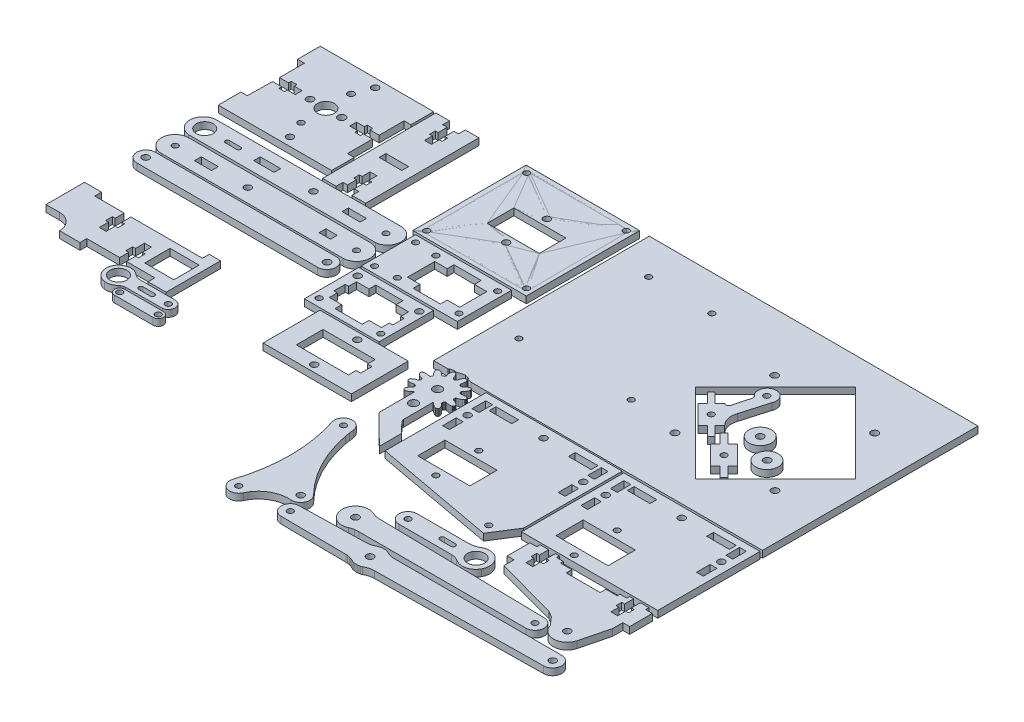
from build123d import *

# Parameters (mm, degrees)
SKETCH3_R              = 3.75
SKETCH3_R_2            = 1.53326
SKETCH3_R_3            = 1.42391285
SKETCH3_R_4            = 1.648176726
SKETCH3_R_5            = 1.5
SKETCH3_R_6            = 1.352434515
SKETCH3_R_7            = 1.489057141
BOSS_EXTRUDE1_DEPTH    = 3
SKETCH5_W              = 10
SKETCH5_H              = 3
BOSS_EXTRUDE2_DEPTH    = 3
SKETCH8_R              = 1.5
SKETCH8_R_2            = 1.500007616
SKETCH8_R_3            = 1.299978659
SKETCH8_R_4            = 1.299998754
SKETCH8_R_5            = 1.294984531
SKETCH8_R_6            = 1.2999789
SKETCH8_W              = 23
SKETCH8_H              = 11.8
BOSS_EXTRUDE3_DEPTH    = 3
SKETCH14_R             = 5.00001662
SKETCH14_R_2           = 1.550029918
BOSS_EXTRUDE5_DEPTH    = 3
SKETCH14_R_3           = 5.003976988
SKETCH14_R_4           = 1.550023427
BOSS_EXTRUDE5_2_DEPTH  = 3
SKETCH14_R_5           = 1.299993938
SKETCH14_R_6           = 1.300026864
BOSS_EXTRUDE5_3_DEPTH  = 3
SKETCH14_R_7           = 1.299969961
BOSS_EXTRUDE5_4_DEPTH  = 3
SKETCH10_W             = 145.044336183
SKETCH10_H             = 95.097461227
SKETCH10_R             = 1.550506139
SKETCH10_R_2           = 1.300168844
SKETCH10_R_3           = 1.2905
SKETCH10_R_4           = 1.55
SKETCH10_R_5           = 1.564093454
SKETCH10_R_6           = 1.556446812
BOSS_EXTRUDE4_DEPTH    = 3
SKETCH16_W             = 60.073762511
SKETCH16_H             = 45.112571339
SKETCH16_R             = 1.5
SKETCH16_R_2           = 1.2999789
SKETCH16_R_3           = 1.296234989
SKETCH16_R_4           = 1.500012067
SKETCH16_W_2           = 10
SKETCH16_H_2           = 3
SKETCH16_W_3           = 3
SKETCH16_H_3           = 6
SKETCH16_W_4           = 23
SKETCH16_H_4           = 12
BOSS_EXTRUDE6_DEPTH    = 3
SKETCH18_R             = 1.3
SKETCH18_R_2           = 3.75
BOSS_EXTRUDE7_DEPTH    = 3
SKETCH18_R_3           = 1.300013016
SKETCH18_R_4           = 1.549974532
BOSS_EXTRUDE7_2_DEPTH  = 3
SKETCH18_R_5           = 1.300006116
SKETCH18_R_6           = 1.54998491
SKETCH18_R_7           = 1.499986033
BOSS_EXTRUDE7_3_DEPTH  = 3
SKETCH18_R_8           = 1.500000462
SKETCH18_R_9           = 1.300040399
SKETCH18_R_10          = 1.299952653
BOSS_EXTRUDE7_4_DEPTH  = 3
SKETCH18_W             = 12.829032701
SKETCH18_H             = 11.189767412
BOSS_EXTRUDE7_5_DEPTH  = 3
SKETCH18_R_11          = 3.750002352
BOSS_EXTRUDE7_6_DEPTH  = 3
SKETCH18_R_12          = 1.300003796
SKETCH18_R_13          = 1.299998754
BOSS_EXTRUDE7_7_DEPTH  = 3
SKETCH18_W_2           = 42.429633814
SKETCH18_H_2           = 23.954946388
SKETCH18_R_14          = 1.298883823
SKETCH18_R_15          = 1.299997434
SKETCH18_R_16          = 1.298943094
SKETCH18_R_17          = 1.299995677
SKETCH18_R_18          = 1.2989
SKETCH18_R_19          = 1.30391221
BOSS_EXTRUDE7_8_DEPTH  = 3
SKETCH18_W_3           = 32.923456075
SKETCH18_H_3           = 23.983775616
SKETCH18_R_20          = 1.501568812
SKETCH18_R_21          = 1.29891
SKETCH18_R_22          = 1.30127611
SKETCH18_R_23          = 1.500007616
BOSS_EXTRUDE7_9_DEPTH  = 3
SKETCH18_R_24          = 3.750099942
SKETCH18_R_25          = 1.5
SKETCH18_W_4           = 8
SKETCH18_H_4           = 2.8
SKETCH18_W_5           = 9
SKETCH18_H_5           = 2.9
BOSS_EXTRUDE7_10_DEPTH = 3
SKETCH18_R_26          = 1.299997387
SKETCH18_W_6           = 7.5
SKETCH18_H_6           = 3
SKETCH18_W_7           = 5
BOSS_EXTRUDE7_11_DEPTH = 3
SKETCH18_R_27          = 1.550000311
SKETCH18_R_28          = 1.550002261
BOSS_EXTRUDE7_12_DEPTH = 3
SKETCH18_W_8           = 38.915686477
SKETCH18_H_7           = 25.075379571
BOSS_EXTRUDE7_13_DEPTH = 3
SKETCH17_R             = 1.5
BOSS_EXTRUDE8_DEPTH    = 3
SKETCH23_R             = 1.502981158
SKETCH23_R_2           = 1.299837753
SKETCH23_R_3           = 1.299813959
SKETCH23_R_4           = 1.311183002
SKETCH23_R_5           = 1.5
SKETCH23_W             = 10
SKETCH23_H             = 3
SKETCH23_W_2           = 3
SKETCH23_H_2           = 6
SKETCH23_W_3           = 23
SKETCH23_H_3           = 12
BOSS_EXTRUDE9_DEPTH    = 3
SKETCH27_R             = 10.542052595
BOSS_EXTRUDE13_DEPTH   = 3
CUT_EXTRUDE5_START     = -1
CUT_EXTRUDE5_DEPTH     = 348.879953887
CIRPATTERN1_COUNT      = 12
SKETCH28_R             = 1.9
BOSS_EXTRUDE14_DEPTH   = 3
SKETCH29_R             = 1.9
CUT_EXTRUDE6_DEPTH     = 3
SKETCH30_W             = 50.052698669
SKETCH30_H             = 49.917064019
SKETCH30_R             = 1.295977319
SKETCH30_R_2           = 1.498315826
SKETCH30_R_3           = 1.299978659
SKETCH30_R_4           = 1.493585645
SKETCH30_R_5           = 1.298054303
SKETCH30_R_6           = 1.295949613
SKETCH30_W_2           = 23.14749428
SKETCH30_H_2           = 11.799314187
BOSS_EXTRUDE15_DEPTH   = 3


with BuildPart() as part:
    # Sketch3 → Boss-Extrude1 (new body)
    with BuildSketch(Plane(origin=(0, 0, 0), x_dir=(1, 0, 0), z_dir=(0, 1, 0))):
        Polygon((0, 0), (50, 0), (50, -10), (47, -10), (47, -21), (43, -21), (43, -19.82589), (40.5, -19.75), (40.5, -21), (37, -21), (37, -24), (40.5, -24), (40.5, -25.274955495), (43, -25.25), (43, -24), (47, -24), (47, -35), (50, -35), (50, -45), (0, -45), (0, -35), (2.827127063, -35), (3, -24), (7, -24), (7, -25.274955495), (9.5, -25.17411), (9.5, -24), (13, -24), (13, -21), (9.5, -21), (9.5, -19.82589), (7, -19.82589), (7, -21), (3, -21), (3, -10), (0, -10), align=None)
        with Locations((25, -22.499992494)):
            Circle(SKETCH3_R, mode=Mode.SUBTRACT)
        with Locations((18, -22.5)):
            Circle(SKETCH3_R_2, mode=Mode.SUBTRACT)
        with Locations((24.990375, -11.417625)):
            Circle(SKETCH3_R_3, mode=Mode.SUBTRACT)
        with Locations((31.950646971, -22.511932172)):
            Circle(SKETCH3_R_4, mode=Mode.SUBTRACT)
        with Locations((28, -3.75)):
            Circle(SKETCH3_R_5, mode=Mode.SUBTRACT)
        with Locations((25, -33.494077682)):
            Circle(SKETCH3_R_6, mode=Mode.SUBTRACT)
        with Locations((27.986369291, -41.339428739)):
            Circle(SKETCH3_R_7, mode=Mode.SUBTRACT)
    extrude(amount=BOSS_EXTRUDE1_DEPTH)


with BuildPart() as body_2:
    # Sketch5 → Boss-Extrude2 (new body)
    with BuildSketch(Plane(origin=(0, 0, 0), x_dir=(1, 0, 0), z_dir=(0, 1, 0))):
        Polygon((57, 0), (57, -3), (59, -3), (59, -7), (57.75, -7), (57.75, -9.5), (59, -9.5), (59, -13), (62, -13), (62, -9.5), (63.25, -9.5), (63.25, -7), (62, -7), (62, -3), (64, -3), (64, 0), (70, 0), (70, -50), (64, -50), (64, -47), (62, -47), (62, -43), (63.25, -43), (63.25, -40.5), (62, -40.5), (62, -37), (59, -37), (59, -40.5), (57.75, -40.5), (57.75, -43), (59, -43), (59, -47), (57, -47), (57, -50), (51, -50), (51, 0), align=None)
        with Locations((60.5, -28)):
            Rectangle(SKETCH5_W, SKETCH5_H, mode=Mode.SUBTRACT)
    extrude(amount=BOSS_EXTRUDE2_DEPTH)


with BuildPart() as body_3:
    # Sketch8 → Boss-Extrude3 (new body)
    with BuildSketch(Plane(origin=(0, 0, 0), x_dir=(1, 0, 0), z_dir=(0, 1, 0))):
        Polygon((90.835790983, -0.1468305), (90.835790983, -49.979936215), (140.829753359, -49.979936215), (140.829753359, 0), align=None)
        with Locations((116, -16.000034227)):
            Circle(SKETCH8_R, mode=Mode.SUBTRACT)
        with Locations((116, -34)):
            Circle(SKETCH8_R_2, mode=Mode.SUBTRACT)
        with Locations((138, -3)):
            Circle(SKETCH8_R_3, mode=Mode.SUBTRACT)
        with Locations((94, -47)):
            Circle(SKETCH8_R_4, mode=Mode.SUBTRACT)
        with Locations((93.972384297, -2.870240899)):
            Circle(SKETCH8_R_5, mode=Mode.SUBTRACT)
        with Locations((138, -47)):
            Circle(SKETCH8_R_6, mode=Mode.SUBTRACT)
        with Locations((116, -25)):
            Rectangle(SKETCH8_W, SKETCH8_H, mode=Mode.SUBTRACT)
    extrude(amount=BOSS_EXTRUDE3_DEPTH)


with BuildPart() as body_4:
    # Sketch14 → Boss-Extrude5 (new body)
    with BuildSketch(Plane(origin=(0, 0, 0), x_dir=(1, 0, 0), z_dir=(0, 1, 0))):
        with Locations((246.15535, -52.035605)):
            Circle(SKETCH14_R)
        with Locations((246.15535, -52.035605)):
            Circle(SKETCH14_R_2, mode=Mode.SUBTRACT)
    extrude(amount=BOSS_EXTRUDE5_DEPTH)


with BuildPart() as body_5:
    # Sketch14 → Boss-Extrude5 2 (new body)
    with BuildSketch(Plane(origin=(0, 0, 0), x_dir=(1, 0, 0), z_dir=(0, 1, 0))):
        with Locations((256.781771683, -59.687732945)):
            Circle(SKETCH14_R_3)
        with Locations((256.82285, -59.64665)):
            Circle(SKETCH14_R_4, mode=Mode.SUBTRACT)
    extrude(amount=BOSS_EXTRUDE5_2_DEPTH)


with BuildPart() as body_6:
    # Sketch14 → Boss-Extrude5 3 (new body)
    with BuildSketch(Plane(origin=(0, 0, 0), x_dir=(1, 0, 0), z_dir=(0, 1, 0))):
        with BuildLine():
            Line((234.1407, -55.70278), (232.0194, -57.8241))
            Line((232.0194, -57.8241), (236.262, -62.06674))
            Line((236.262, -62.06674), (234.565, -63.7638))
            Line((234.565, -63.7638), (230.3223, -59.52115))
            Line((230.3223, -59.52115), (228.201, -61.64247))
            Line((228.201, -61.64247), (219.7157, -53.15719))
            Line((219.7157, -53.15719), (221.837, -51.03587))
            Line((221.837, -51.03587), (217.5944, -46.79323))
            Line((217.5944, -46.79323), (219.2915, -45.09618))
            Line((219.2915, -45.09618), (223.5341, -49.33882))
            Line((223.5341, -49.33882), (225.6554, -47.2175))
            ThreePointArc((225.6554, -47.2175), (227.096966061, -47.504240019), (227.913545624, -46.282139221))
            Line((227.913545624, -46.282139221), (229.7551, -39.43538))
            Line((229.7551, -39.43538), (229.7551, -38.198592891))
            ThreePointArc((229.7551, -38.198592891), (231.075391639, -31.018520336), (235.828906167, -36.559342615))
            Line((235.828906167, -36.559342615), (232.44365, -48.27816))
            ThreePointArc((232.44365, -48.27816), (232.223292436, -52.234785151), (234.1407, -55.70278))
        make_face()
        with Locations((232.1046, -35.11147)):
            Circle(SKETCH14_R_5, mode=Mode.SUBTRACT)
        with Locations((226.9282, -54.429985)):
            Circle(SKETCH14_R_6, mode=Mode.SUBTRACT)
    extrude(amount=BOSS_EXTRUDE5_3_DEPTH)


with BuildPart() as body_7:
    # Sketch14 → Boss-Extrude5 4 (new body)
    with BuildSketch(Plane(origin=(0, 0, 0), x_dir=(1, 0, 0), z_dir=(0, 1, 0))):
        Polygon((244.0402, -59.94542), (252.5255, -68.4307), (250.4042, -70.55202), (254.6468, -74.79466), (252.9497, -76.49172), (248.7071, -72.24908), (246.5858, -74.3704), (238.1005, -65.88512), (240.2218, -63.7638), (235.9792, -59.52115), (237.6762, -57.8241), (241.9189, -62.06674), align=None)
        with Locations((245.313, -67.157905)):
            Circle(SKETCH14_R_7, mode=Mode.SUBTRACT)
    extrude(amount=BOSS_EXTRUDE5_4_DEPTH)


with BuildPart() as body_8:
    # Sketch10 → Boss-Extrude4 (new body)
    with BuildSketch(Plane(origin=(0, 0, 0), x_dir=(1, 0, 0), z_dir=(0, 1, 0))):
        with Locations((217.677521451, -47.548730614)):
            Rectangle(SKETCH10_W, SKETCH10_H)
        with Locations((226.009129523, -25.539997746)):
            Circle(SKETCH10_R, mode=Mode.SUBTRACT)
        with Locations((188.502678827, -15.722061434)):
            Circle(SKETCH10_R_2, mode=Mode.SUBTRACT)
        with Locations((160.602678827, -15.722061434)):
            Circle(SKETCH10_R_2, mode=Mode.SUBTRACT)
        with Locations((155.5, -67.875)):
            Circle(SKETCH10_R_3, mode=Mode.SUBTRACT)
        with Locations((203.702678827, -66.522061434)):
            Circle(SKETCH10_R_2, mode=Mode.SUBTRACT)
        with Locations((226, -69.5)):
            Circle(SKETCH10_R_4, mode=Mode.SUBTRACT)
        with Locations((270.124359095, -25.491820621)):
            Circle(SKETCH10_R_5, mode=Mode.SUBTRACT)
        with Locations((270.107264834, -69.483321735)):
            Circle(SKETCH10_R_6, mode=Mode.SUBTRACT)
        Polygon((248.173093133, -12.095839846), (283.382605742, -47.305352454), (248.173093133, -82.514865063), (212.963580525, -47.305352454), align=None, mode=Mode.SUBTRACT)
    extrude(amount=BOSS_EXTRUDE4_DEPTH)

    # Sketch27 → Boss-Extrude13 (add)
    with BuildSketch(Plane(origin=(0, 0, 0), x_dir=(1, 0, 0), z_dir=(0, 1, 0))):
        with Locations((156.933289023, -105.157126991)):
            Circle(SKETCH27_R)
    extrude(amount=BOSS_EXTRUDE13_DEPTH)

    # Sketch24 → Cut-Extrude5 (cut)
    with BuildSketch(Plane(origin=(0, 0, 0), x_dir=(1, 0, 0), z_dir=(0, 1, 0)).offset(CUT_EXTRUDE5_START)):
        Polygon((146.295463365, -102.258026196), (146.734120528, -102.514029645), (146.734120528, -102.846697253), (146.8825, -103.1532), (147.0178, -103.3192), (147.4553, -103.675), (147.9381, -103.9665), (148.4567, -104.1881), (149.001, -104.3353), (149.2258, -104.4129), (149.421, -104.5485), (149.572, -104.7322), (149.6674, -104.9499), (149.6674, -105.086518838), (149.6674, -105.35931762), (149.6674, -105.57468508), (149.421, -105.8223), (149.1134, -105.957095774), (148.843969569, -106.075164966), (148.4567, -106.1828), (147.9381, -106.4044), (147.4553, -106.723311534), (147.0178, -107.0517), (146.8825, -107.2176), (146.7646, -107.6252), (146.7905, -107.8378), (146.387479964, -107.886897925), (145.400373324, -104.3353), (145.873599656, -102.6992775), align=None)
    cut_extrude5 = extrude(amount=CUT_EXTRUDE5_DEPTH, mode=Mode.SUBTRACT)

    # CirPattern1: Cut-Extrude5 ×12 about axis
    cirpattern1_axis = Axis((156.933289023, 3, 105.157126991), (0, -1, 0))
    for i in range(1, CIRPATTERN1_COUNT):
        add(cut_extrude5.rotate(cirpattern1_axis, i * 360 / CIRPATTERN1_COUNT), mode=Mode.SUBTRACT)

    # Sketch28 → Boss-Extrude14 (add)
    with BuildSketch(Plane(origin=(0, 0, 0), x_dir=(1, 0, 0), z_dir=(0, 1, 0))):
        Polygon((165.897383159, -139.82250261), (165.897383159, -130.125905708), (161.277, -125.2548), (160.9869, -124.3621), (160.927849447, -111.240792422), (152.884646942, -111.319726794), (152.884646942, -126.99508265), align=None)
        with Locations((156.95902597, -115.808287016)):
            Circle(SKETCH28_R, mode=Mode.SUBTRACT)
    extrude(amount=BOSS_EXTRUDE14_DEPTH)

    # Sketch29 → Cut-Extrude6 (cut)
    with BuildSketch(Plane(origin=(0, 0, 0), x_dir=(1, 0, 0), z_dir=(0, 1, 0))):
        with Locations((156.916793387, -105.137173192)):
            Circle(SKETCH29_R)
    extrude(amount=CUT_EXTRUDE6_DEPTH, mode=Mode.SUBTRACT)


with BuildPart() as body_9:
    # Sketch16 → Boss-Extrude6 (new body)
    with BuildSketch(Plane(origin=(0, 0, 0), x_dir=(1, 0, 0), z_dir=(0, 1, 0))):
        with Locations((260.007317348, -118.580980031)):
            Rectangle(SKETCH16_W, SKETCH16_H)
        with Locations((260, -100.5)):
            Circle(SKETCH16_R, mode=Mode.SUBTRACT)
        with Locations((250.5, -119.5)):
            Circle(SKETCH16_R_2, mode=Mode.SUBTRACT)
        with Locations((250.5, -138.465098587)):
            Circle(SKETCH16_R_3, mode=Mode.SUBTRACT)
        with Locations((285.5, -108.5)):
            Circle(SKETCH16_R, mode=Mode.SUBTRACT)
        with Locations((234.5, -108.5)):
            Circle(SKETCH16_R_4, mode=Mode.SUBTRACT)
        with Locations((242.5, -100.5)):
            Rectangle(SKETCH16_W_2, SKETCH16_H_2, mode=Mode.SUBTRACT)
        with Locations((277.5, -100.5)):
            Rectangle(SKETCH16_W_2, SKETCH16_H_2, mode=Mode.SUBTRACT)
        with Locations((285.5, -102)):
            Rectangle(SKETCH16_W_3, SKETCH16_H_3, mode=Mode.SUBTRACT)
        with Locations((285.5, -115)):
            Rectangle(SKETCH16_W_3, SKETCH16_H_3, mode=Mode.SUBTRACT)
        with Locations((250.5, -129)):
            Rectangle(SKETCH16_W_4, SKETCH16_H_4, mode=Mode.SUBTRACT)
        with Locations((234.5, -115)):
            Rectangle(SKETCH16_W_3, SKETCH16_H_3, mode=Mode.SUBTRACT)
        with Locations((234.5, -102)):
            Rectangle(SKETCH16_W_3, SKETCH16_H_3, mode=Mode.SUBTRACT)
    extrude(amount=BOSS_EXTRUDE6_DEPTH)


with BuildPart() as body_10:
    # Sketch18 → Boss-Extrude7 (new body)
    with BuildSketch(Plane(origin=(0, 0, 0), x_dir=(1, 0, 0), z_dir=(0, 1, 0))):
        with BuildLine():
            Line((200, -157.2561), (222.460912978, -157.2561))
            ThreePointArc((222.460912978, -157.2561), (225.201625308, -156.860687351), (227.7188, -155.7067))
            ThreePointArc((227.7188, -155.7067), (234.425465186, -157.247273828), (235.304856395, -164.072183846))
            ThreePointArc((235.304856395, -164.072183846), (231.298299739, -167.169454238), (226.342, -166.1299))
            ThreePointArc((226.342, -166.1299), (224.771562074, -165.505823803), (223.0953, -165.2916))
            Line((223.0953, -165.2916), (200, -165.2561))
            ThreePointArc((200, -165.2561), (196, -161.2561), (200, -157.2561))
        make_face()
        with Locations((200, -161.2561)):
            Circle(SKETCH18_R, mode=Mode.SUBTRACT)
        with Locations((230, -161.2561)):
            Circle(SKETCH18_R_2, mode=Mode.SUBTRACT)
        with BuildLine():
            Line((215.010554012, -160.267363361), (219.919025801, -160.267363361))
            ThreePointArc((219.919025801, -160.267363361), (220.932172771, -161.280510331), (219.919025801, -162.293657301))
            Line((219.919025801, -162.293657301), (215.010554012, -162.293657301))
            ThreePointArc((215.010554012, -162.293657301), (213.997407042, -161.280510331), (215.010554012, -160.267363361))
        make_face(mode=Mode.SUBTRACT)
    extrude(amount=BOSS_EXTRUDE7_DEPTH)


with BuildPart() as body_11:
    # Sketch18 → Boss-Extrude7 2 (new body)
    with BuildSketch(Plane(origin=(0, 0, 0), x_dir=(1, 0, 0), z_dir=(0, 1, 0))):
        with BuildLine():
            Line((267.8316, -169.0008), (193.5528, -167.5414))
            ThreePointArc((193.5528, -167.5414), (192.887635317, -167.455400386), (192.219, -167.4028))
            ThreePointArc((192.219, -167.4028), (191.55333704, -167.293716328), (190.927, -167.0433))
            ThreePointArc((190.927, -167.0433), (189.004137555, -166.359961344), (186.9656, -166.2666))
            ThreePointArc((186.9656, -166.2666), (183.057707097, -168.375067718), (181.785321347, -172.629277111))
            ThreePointArc((181.785321347, -172.629277111), (182.766023818, -175.434472878), (184.9077, -177.4946))
            ThreePointArc((184.9077, -177.4946), (187.529228779, -178.261740952), (190.201, -177.6938))
            ThreePointArc((190.201, -177.6938), (191.138575639, -177.324647201), (192.1236, -177.1124))
            ThreePointArc((192.1236, -177.1124), (193.072931136, -177.018971757), (194.026338605, -176.987784562))
            Line((194.026338605, -176.987784562), (267.753, -177))
            ThreePointArc((267.753, -177), (271.752817879, -173.03931598), (267.8316, -169.0008))
        make_face()
        with Locations((267.75305, -173)):
            Circle(SKETCH18_R_3, mode=Mode.SUBTRACT)
        with Locations((187.7569, -172.2142)):
            Circle(SKETCH18_R_4, mode=Mode.SUBTRACT)
    extrude(amount=BOSS_EXTRUDE7_2_DEPTH)


with BuildPart() as body_12:
    # Sketch18 → Boss-Extrude7 3 (new body)
    with BuildSketch(Plane(origin=(0, 0, 0), x_dir=(1, 0, 0), z_dir=(0, 1, 0))):
        with BuildLine():
            Line((170.9118, -180.2312), (199.7222, -179.5779))
            ThreePointArc((199.7222, -179.5779), (201.8376067, -179.258428395), (203.8045, -178.4168))
            ThreePointArc((203.8045, -178.4168), (204.091909858, -178.286013473), (204.4002, -178.2177))
            ThreePointArc((204.4002, -178.2177), (204.710444247, -178.165809141), (205.0136, -178.0819))
            ThreePointArc((205.0136, -178.0819), (205.321933314, -178.013737517), (205.6377, -178.0111))
            ThreePointArc((205.6377, -178.0111), (205.951938844, -178.024906904), (206.2659, -178.0058))
            ThreePointArc((206.2659, -178.0058), (206.581681815, -178.003169495), (206.8911, -178.0663))
            ThreePointArc((206.8911, -178.0663), (207.195554991, -178.145209985), (207.5066, -178.1918))
            ThreePointArc((207.5066, -178.1918), (207.816056495, -178.254878116), (208.1056, -178.381))
            ThreePointArc((208.1056, -178.381), (208.387003464, -178.521505982), (208.6816, -178.6317))
            ThreePointArc((208.6816, -178.6317), (209.028512895, -178.762712354), (209.3587, -178.9315))
            ThreePointArc((209.3587, -178.9315), (209.697618418, -179.085368069), (210.0607, -179.1673))
            ThreePointArc((210.0607, -179.1673), (210.425847774, -179.23210759), (210.7815, -179.3372))
            ThreePointArc((210.7815, -179.3372), (211.142946952, -179.426036198), (211.5149, -179.4397))
            ThreePointArc((211.5149, -179.4397), (211.885759287, -179.436159612), (212.2547, -179.474))
            Line((212.2547, -179.474), (286, -179.474))
            ThreePointArc((286, -179.474), (289.999936464, -183.44772236), (286.0526, -187.4737))
            Line((286.0526, -187.4737), (212.3137, -188.4434))
            ThreePointArc((212.3137, -188.4434), (210.172193977, -188.749428152), (208.1793, -189.5909))
            ThreePointArc((208.1793, -189.5909), (207.891445225, -189.720719249), (207.5829, -189.7879))
            ThreePointArc((207.5829, -189.7879), (207.272504044, -189.838638491), (206.9691, -189.9215))
            ThreePointArc((206.9691, -189.9215), (206.660508026, -189.988642594), (206.3447, -189.9902))
            ThreePointArc((206.3447, -189.9902), (206.030521556, -189.975273726), (205.7165, -189.9932))
            ThreePointArc((205.7165, -189.9932), (205.400707852, -189.994666467), (205.0915, -189.9305))
            ThreePointArc((205.0915, -189.9305), (204.787292957, -189.850585166), (204.4764, -189.8029))
            ThreePointArc((204.4764, -189.8029), (204.167188014, -189.738719346), (203.8781, -189.6116))
            ThreePointArc((203.8781, -189.6116), (203.597188037, -189.470098991), (203.303, -189.3588))
            ThreePointArc((203.303, -189.3588), (202.961060971, -189.228132955), (202.6358, -189.0602))
            ThreePointArc((202.6358, -189.0602), (202.302040587, -188.90677466), (201.9442, -188.8238))
            ThreePointArc((201.9442, -188.8238), (201.584178805, -188.757466456), (201.2338, -188.6514))
            ThreePointArc((201.2338, -188.6514), (200.877693771, -188.56114241), (200.5107, -188.5446))
            ThreePointArc((200.5107, -188.5446), (200.14467333, -188.544853065), (199.7809, -188.5043))
            Line((199.7809, -188.5043), (170.9644, -188.2299))
            ThreePointArc((170.9644, -188.2299), (167.002618868, -184.256429994), (170.9118, -180.2312))
        make_face()
        with Locations((171.00245, -184.2301)):
            Circle(SKETCH18_R_5, mode=Mode.SUBTRACT)
        with Locations((206.00175, -184)):
            Circle(SKETCH18_R_6, mode=Mode.SUBTRACT)
        with Locations((286, -183.474)):
            Circle(SKETCH18_R_7, mode=Mode.SUBTRACT)
    extrude(amount=BOSS_EXTRUDE7_3_DEPTH)


with BuildPart() as body_13:
    # Sketch18 → Boss-Extrude7 4 (new body)
    with BuildSketch(Plane(origin=(0, 0, 0), x_dir=(1, 0, 0), z_dir=(0, 1, 0))):
        with BuildLine():
            Line((154.2411, -141.4201), (154.5835, -143.5068))
            ThreePointArc((154.5835, -143.5068), (160.144624366, -159.404783515), (170.0608, -173.0188))
            ThreePointArc((170.0608, -173.0188), (170.830688309, -177.531456134), (166.8709, -179.8286))
            ThreePointArc((166.8709, -179.8286), (159.030856109, -181.627977059), (153.6593, -187.6155))
            ThreePointArc((153.6593, -187.6155), (148.567775867, -189.700195924), (146.2067, -184.7308))
            ThreePointArc((146.2067, -184.7308), (149.661659143, -162.874197015), (146.170332469, -141.023373809))
            ThreePointArc((146.170332469, -141.023373809), (149.132248913, -135.851413376), (153.9775, -139.3221))
            Line((153.9775, -139.3221), (154.2411, -141.4201))
        make_face()
        with Locations((167.22995, -175.84475)):
            Circle(SKETCH18_R_8, mode=Mode.SUBTRACT)
        with Locations((150, -186)):
            Circle(SKETCH18_R_9, mode=Mode.SUBTRACT)
        with Locations((150, -139.7458)):
            Circle(SKETCH18_R_10, mode=Mode.SUBTRACT)
    extrude(amount=BOSS_EXTRUDE7_4_DEPTH)


with BuildPart() as body_14:
    # Sketch18 → Boss-Extrude7 5 (new body)
    with BuildSketch(Plane(origin=(0, 0, 0), x_dir=(1, 0, 0), z_dir=(0, 1, 0))):
        with BuildLine():
            Line((20.5, -107), (7.5, -107))
            Line((7.5, -107), (7.5, -104))
            Line((7.5, -104), (0, -104))
            Line((0, -104), (0, -121))
            Line((0, -121), (6, -121))
            ThreePointArc((6, -121), (10.949747468, -123.050252532), (13, -128))
            Line((13, -128), (22, -128))
            Line((22, -128), (22, -125))
            Line((22, -125), (36.5, -125))
            Line((36.5, -125), (36.5, -121))
            Line((36.5, -121), (35.25, -121))
            Line((35.25, -121), (35.25, -118))
            Line((35.25, -118), (36.5, -118))
            Line((36.5, -118), (36.5, -114))
            Line((36.5, -114), (39.5, -114))
            Line((39.5, -114), (39.5, -118))
            Line((39.5, -118), (40.75, -118))
            Line((40.75, -118), (40.75, -121))
            Line((40.75, -121), (39.5, -121))
            Line((39.5, -121), (39.5, -125))
            Line((39.5, -125), (52, -125))
            Line((52, -125), (52, -128))
            Line((52, -128), (60, -128))
            Line((60, -128), (60, -104))
            Line((60, -104), (55, -104))
            Line((55, -104), (55, -107))
            Line((55, -107), (23.5, -107))
            Line((23.5, -107), (23.5, -111))
            Line((23.5, -111), (24.75, -111))
            Line((24.75, -111), (24.75, -114))
            Line((24.75, -114), (23.5, -114))
            Line((23.5, -114), (23.5, -118))
            Line((23.5, -118), (20.5, -118))
            Line((20.5, -118), (20.5, -114))
            Line((20.5, -114), (19.25, -114))
            Line((19.25, -114), (19.25, -111))
            Line((19.25, -111), (20.5, -111))
            Line((20.5, -111), (20.5, -107))
        make_face()
        with Locations((50.526628558, -115.951763078)):
            Rectangle(SKETCH18_W, SKETCH18_H, mode=Mode.SUBTRACT)
    extrude(amount=BOSS_EXTRUDE7_5_DEPTH)


with BuildPart() as body_15:
    # Sketch18 → Boss-Extrude7 6 (new body)
    with BuildSketch(Plane(origin=(0, 0, 0), x_dir=(1, 0, 0), z_dir=(0, 1, 0))):
        with BuildLine():
            Line((64.95448, -129), (49.75522, -129))
            ThreePointArc((49.75522, -129), (47.712701098, -128.587313557), (45.99063, -127.414))
            ThreePointArc((45.99063, -127.414), (37.87780457, -130.093403704), (42.22112, -137.4509))
            ThreePointArc((42.22112, -137.4509), (44.797074902, -137.216380757), (46.98538, -135.8373))
            ThreePointArc((46.98538, -135.8373), (47.218685761, -135.655018367), (47.49213, -135.5415))
            ThreePointArc((47.49213, -135.5415), (48.051403531, -135.365158762), (48.59174, -135.1373))
            Line((48.59174, -135.1373), (49.16944, -135.0344))
            Line((49.16944, -135.0344), (65.42379, -134.9631))
            ThreePointArc((65.42379, -134.9631), (67.945249696, -131.764637289), (64.95448, -129))
        make_face()
        with Locations((42.95448, -132)):
            Circle(SKETCH18_R_11, mode=Mode.SUBTRACT)
        with Locations((64.95448, -132)):
            Circle(SKETCH18_R, mode=Mode.SUBTRACT)
        with BuildLine():
            Line((52.879559015, -131.026796451), (57.938701055, -131.026796451))
            ThreePointArc((57.938701055, -131.026796451), (58.911922505, -132.000017901), (57.938701055, -132.97323935))
            Line((57.938701055, -132.97323935), (52.879559015, -132.97323935))
            ThreePointArc((52.879559015, -132.97323935), (51.906337565, -132.000017901), (52.879559015, -131.026796451))
        make_face(mode=Mode.SUBTRACT)
    extrude(amount=BOSS_EXTRUDE7_6_DEPTH)


with BuildPart() as body_16:
    # Sketch18 → Boss-Extrude7 7 (new body)
    with BuildSketch(Plane(origin=(0, 0, 0), x_dir=(1, 0, 0), z_dir=(0, 1, 0))):
        with BuildLine():
            Line((49.75522, -136), (66.75522, -136))
            ThreePointArc((66.75522, -136), (69.00522, -138.25), (66.75522, -140.5))
            Line((66.75522, -140.5), (49.75522, -140.5))
            ThreePointArc((49.75522, -140.5), (47.50522, -138.25), (49.75522, -136))
        make_face()
        with Locations((49.75522, -138.25)):
            Circle(SKETCH18_R_12, mode=Mode.SUBTRACT)
        with Locations((66.75522, -138.25)):
            Circle(SKETCH18_R_13, mode=Mode.SUBTRACT)
    extrude(amount=BOSS_EXTRUDE7_7_DEPTH)


with BuildPart() as body_17:
    # Sketch18 → Boss-Extrude7 8 (new body)
    with BuildSketch(Plane(origin=(0, 0, 0), x_dir=(1, 0, 0), z_dir=(0, 1, 0))):
        with Locations((114.225592474, -62.995130295)):
            Rectangle(SKETCH18_W_2, SKETCH18_H_2)
        with Locations((105.5, -71.5)):
            Circle(SKETCH18_R_14, mode=Mode.SUBTRACT)
        with Locations((96, -72.05)):
            Circle(SKETCH18_R_15, mode=Mode.SUBTRACT)
        with Locations((105.5, -54.5)):
            Circle(SKETCH18_R_16, mode=Mode.SUBTRACT)
        with Locations((96, -53.95)):
            Circle(SKETCH18_R_17, mode=Mode.SUBTRACT)
        with Locations((132.7, -71.5)):
            Circle(SKETCH18_R_18, mode=Mode.SUBTRACT)
        with Locations((132.704492308, -54.463182304)):
            Circle(SKETCH18_R_19, mode=Mode.SUBTRACT)
        Polygon((113, -54), (125, -54), (125, -57), (130.5, -57), (130.5, -69), (125, -69), (125, -72), (113, -72), (113, -69), (107.5, -69), (107.5, -57), (113, -57), align=None, mode=Mode.SUBTRACT)
    extrude(amount=BOSS_EXTRUDE7_8_DEPTH)


with BuildPart() as body_18:
    # Sketch18 → Boss-Extrude7 9 (new body)
    with BuildSketch(Plane(origin=(0, 0, 0), x_dir=(1, 0, 0), z_dir=(0, 1, 0))):
        with Locations((109.472503605, -88.008698539)):
            Rectangle(SKETCH18_W_3, SKETCH18_H_3)
        with Locations((95.995543612, -79.512733943)):
            Circle(SKETCH18_R_20, mode=Mode.SUBTRACT)
        with Locations((96, -96.5)):
            Circle(SKETCH18_R_21, mode=Mode.SUBTRACT)
        with Locations((123.206540144, -96.482670767)):
            Circle(SKETCH18_R_22, mode=Mode.SUBTRACT)
        with Locations((123.2, -79.5)):
            Circle(SKETCH18_R_23, mode=Mode.SUBTRACT)
        Polygon((103.5, -79), (115.5, -79), (115.5, -82), (121, -82), (121, -85.5), (122.5, -85.5), (122.5, -90.5), (121, -90.5), (121, -94), (115.5, -94), (115.5, -97), (103.5, -97), (103.5, -94), (98, -94), (98, -90.5), (96.5, -90.5), (96.5, -85.5), (98, -85.5), (98, -82), (103.5, -82), align=None, mode=Mode.SUBTRACT)
    extrude(amount=BOSS_EXTRUDE7_9_DEPTH)


with BuildPart() as body_19:
    # Sketch18 → Boss-Extrude7 10 (new body)
    with BuildSketch(Plane(origin=(0, 0, 0), x_dir=(1, 0, 0), z_dir=(0, 1, 0))):
        with BuildLine():
            Line((5.328213, -51.03773), (86.67179, -51.03773))
            ThreePointArc((86.67179, -51.03773), (92.587015781, -56.630083622), (87.33513, -62.84957))
            Line((87.33513, -62.84957), (4.664874, -62.84957))
            ThreePointArc((4.664874, -62.84957), (-0.587012753, -56.630084068), (5.328213, -51.03773))
        make_face()
        with Locations((6.007668696, -56.973882888)):
            Circle(SKETCH18_R_24, mode=Mode.SUBTRACT)
        with Locations((86, -57)):
            Circle(SKETCH18_R, mode=Mode.SUBTRACT)
        with Locations((54, -57)):
            Circle(SKETCH18_R_25, mode=Mode.SUBTRACT)
        with Locations((72, -57)):
            Rectangle(SKETCH18_W_4, SKETCH18_H_4, mode=Mode.SUBTRACT)
        with Locations((33.5, -56.95)):
            Rectangle(SKETCH18_W_5, SKETCH18_H_5, mode=Mode.SUBTRACT)
        with BuildLine():
            Line((16, -56.088578854), (20.972747325, -56.088578854))
            ThreePointArc((20.972747325, -56.088578854), (21.858051359, -56.973882888), (20.972747325, -57.859186922))
            Line((20.972747325, -57.859186922), (16, -57.859186922))
            ThreePointArc((16, -57.859186922), (15.114695966, -56.973882888), (16, -56.088578854))
        make_face(mode=Mode.SUBTRACT)
    extrude(amount=BOSS_EXTRUDE7_10_DEPTH)


with BuildPart() as body_20:
    # Sketch18 → Boss-Extrude7 11 (new body)
    with BuildSketch(Plane(origin=(0, 0, 0), x_dir=(1, 0, 0), z_dir=(0, 1, 0))):
        with BuildLine():
            Line((86, -64), (6, -64))
            ThreePointArc((6, -64), (-0.053754882, -69.963055849), (5.909300967, -76.016810731))
            Line((5.909300967, -76.016810731), (86, -76))
            Line((86, -76), (86, -76.016810731))
            ThreePointArc((86, -76.016810731), (92.008405366, -70.008405366), (86, -64))
        make_face()
        with Locations((86, -70)):
            Circle(SKETCH18_R_26, mode=Mode.SUBTRACT)
        with Locations((38, -70)):
            Circle(SKETCH18_R_25, mode=Mode.SUBTRACT)
        with Locations((6, -70)):
            Circle(SKETCH18_R, mode=Mode.SUBTRACT)
        with Locations((19.75, -70)):
            Rectangle(SKETCH18_W_6, SKETCH18_H_6, mode=Mode.SUBTRACT)
        with Locations((73.5, -70)):
            Rectangle(SKETCH18_W_7, SKETCH18_H_6, mode=Mode.SUBTRACT)
    extrude(amount=BOSS_EXTRUDE7_11_DEPTH)


with BuildPart() as body_21:
    # Sketch18 → Boss-Extrude7 12 (new body)
    with BuildSketch(Plane(origin=(0, 0, 0), x_dir=(1, 0, 0), z_dir=(0, 1, 0))):
        with BuildLine():
            Line((4.1132945, -76.880456687), (83.901791656, -76.880456687))
            ThreePointArc((83.901791656, -76.880456687), (87.987884236, -80.966549267), (83.901791656, -85.052641847))
            Line((83.901791656, -85.052641847), (4.1132945, -85.052641847))
            ThreePointArc((4.1132945, -85.052641847), (0.02720192, -80.966549267), (4.1132945, -76.880456687))
        make_face()
        with Locations((4, -81)):
            Circle(SKETCH18_R_27, mode=Mode.SUBTRACT)
        with Locations((84, -81)):
            Circle(SKETCH18_R_28, mode=Mode.SUBTRACT)
    extrude(amount=BOSS_EXTRUDE7_12_DEPTH)


with BuildPart() as body_22:
    # Sketch18 → Boss-Extrude7 13 (new body)
    with BuildSketch(Plane(origin=(0, 0, 0), x_dir=(1, 0, 0), z_dir=(0, 1, 0))):
        with Locations((120.256950472, -113.449573571)):
            Rectangle(SKETCH18_W_8, SKETCH18_H_7)
        with Locations((120.3263, -104)):
            Circle(SKETCH18_R_25, mode=Mode.SUBTRACT)
        with Locations((120.3263, -123)):
            Circle(SKETCH18_R_25, mode=Mode.SUBTRACT)
        Polygon((108.8263, -107.6), (131.8263, -107.6), (131.8263, -111), (133.8263, -111), (133.8263, -116), (131.8263, -116), (131.8263, -119.4), (108.8263, -119.4), align=None, mode=Mode.SUBTRACT)
    extrude(amount=BOSS_EXTRUDE7_13_DEPTH)


with BuildPart() as body_23:
    # Sketch17 → Boss-Extrude8 (new body)
    with BuildSketch(Plane(origin=(0, 0, 0), x_dir=(1, 0, 0), z_dir=(0, 1, 0))):
        with BuildLine():
            Line((290, -153.5), (287, -153.5))
            Line((287, -153.5), (287, -157.958081355))
            Line((287, -157.958081355), (283.8136, -170.4839))
            ThreePointArc((283.8136, -170.4839), (278.021486737, -175.04922523), (272.1099, -170.6397))
            Line((272.1099, -170.6397), (269.0056, -167.0206))
            Line((269.0056, -167.0206), (266.265909202, -165.3796907))
            Line((266.265909202, -165.3796907), (239, -158))
            Line((239, -158), (239, -153.5))
            Line((239, -153.5), (236, -153.5))
            Line((236, -153.5), (236, -143.5))
            Line((236, -143.5), (239, -143.5))
            Line((239, -143.5), (239, -142))
            Line((239, -142), (242.75, -142))
            Line((242.75, -142), (242.75, -146))
            Line((242.75, -146), (241.5, -146))
            Line((241.5, -146), (241.5, -148.5))
            Line((241.5, -148.5), (242.75, -148.5))
            Line((242.75, -148.5), (242.75, -152))
            Line((242.75, -152), (245.75, -152))
            Line((245.75, -152), (245.75, -148.5))
            Line((245.75, -148.5), (247, -148.5))
            Line((247, -148.5), (247, -146))
            Line((247, -146), (245.75, -146))
            Line((245.75, -146), (245.75, -142))
            Line((245.75, -142), (247.5, -142))
            Line((247.5, -142), (247.5, -143.25))
            Line((247.5, -143.25), (250.5, -143.25))
            Line((250.5, -143.25), (250.5, -144.5))
            Line((250.5, -144.5), (255.5, -144.5))
            Line((255.5, -144.5), (255.5, -147))
            Line((255.5, -147), (270.5, -147))
            Line((270.5, -147), (270.5, -144.5))
            Line((270.5, -144.5), (275.5, -144.5))
            Line((275.5, -144.5), (275.5, -143.25))
            Line((275.5, -143.25), (278.5, -143.25))
            Line((278.5, -143.25), (278.5, -142))
            Line((278.5, -142), (280.25, -142))
            Line((280.25, -142), (280.25, -146))
            Line((280.25, -146), (279, -146))
            Line((279, -146), (279, -148.5))
            Line((279, -148.5), (280.25, -148.5))
            Line((280.25, -148.5), (280.25, -152))
            Line((280.25, -152), (283.25, -152))
            Line((283.25, -152), (283.25, -148.5))
            Line((283.25, -148.5), (284.5, -148.5))
            Line((284.5, -148.5), (284.5, -146))
            Line((284.5, -146), (283.25, -146))
            Line((283.25, -146), (283.25, -142))
            Line((283.25, -142), (287, -142))
            Line((287, -142), (287, -143.473304253))
            Line((287, -143.473304253), (290, -143.5))
            Line((290, -143.5), (290, -153.5))
        make_face()
        with Locations((278, -169)):
            Circle(SKETCH17_R, mode=Mode.SUBTRACT)
    extrude(amount=BOSS_EXTRUDE8_DEPTH)


with BuildPart() as body_24:
    # Sketch23 → Boss-Extrude9 (new body)
    with BuildSketch(Plane(origin=(0, 0, 0), x_dir=(1, 0, 0), z_dir=(0, 1, 0))):
        Polygon((168.929022495, -95.759791402), (228.984496642, -95.759791402), (228.984496642, -139.251429074), (222.136877094, -150.078070793), (168.929022495, -140.269318467), align=None)
        with Locations((224.513221435, -108.478872745)):
            Circle(SKETCH23_R, mode=Mode.SUBTRACT)
        with Locations((220.252015561, -145.905867006)):
            Circle(SKETCH23_R_2, mode=Mode.SUBTRACT)
        with Locations((189.49966793, -138.501360242)):
            Circle(SKETCH23_R_3, mode=Mode.SUBTRACT)
        with Locations((189.518012925, -119.573065139)):
            Circle(SKETCH23_R_4, mode=Mode.SUBTRACT)
        with Locations((173.5, -108.5)):
            Circle(SKETCH23_R_5, mode=Mode.SUBTRACT)
        with Locations((199, -100.5)):
            Circle(SKETCH23_R_5, mode=Mode.SUBTRACT)
        with Locations((181.5, -100.5)):
            Rectangle(SKETCH23_W, SKETCH23_H, mode=Mode.SUBTRACT)
        with Locations((173.5, -102)):
            Rectangle(SKETCH23_W_2, SKETCH23_H_2, mode=Mode.SUBTRACT)
        with Locations((173.5, -115)):
            Rectangle(SKETCH23_W_2, SKETCH23_H_2, mode=Mode.SUBTRACT)
        with Locations((189.5, -129)):
            Rectangle(SKETCH23_W_3, SKETCH23_H_3, mode=Mode.SUBTRACT)
        with Locations((216.5, -100.5)):
            Rectangle(SKETCH23_W, SKETCH23_H, mode=Mode.SUBTRACT)
        with Locations((224.5, -102)):
            Rectangle(SKETCH23_W_2, SKETCH23_H_2, mode=Mode.SUBTRACT)
        with Locations((224.5, -115)):
            Rectangle(SKETCH23_W_2, SKETCH23_H_2, mode=Mode.SUBTRACT)
    extrude(amount=BOSS_EXTRUDE9_DEPTH)


with BuildPart() as body_25:
    # Sketch30 → Boss-Extrude15 (new body)
    with BuildSketch(Plane(origin=(0, 0, 0), x_dir=(1, 0, 0), z_dir=(0, 1, 0))):
        with Locations((115.88962266, -24.95853201)):
            Rectangle(SKETCH30_W, SKETCH30_H)
        with Locations((93.997507991, -3.007734559)):
            Circle(SKETCH30_R, mode=Mode.SUBTRACT)
        with Locations((116.001611757, -16.011869411)):
            Circle(SKETCH30_R_2, mode=Mode.SUBTRACT)
        with Locations((138.004103617, -2.996533183)):
            Circle(SKETCH30_R_3, mode=Mode.SUBTRACT)
        with Locations((115.998722623, -34.001841427)):
            Circle(SKETCH30_R_4, mode=Mode.SUBTRACT)
        with Locations((138.002535676, -46.993453241)):
            Circle(SKETCH30_R_5, mode=Mode.SUBTRACT)
        with Locations((93.999265257, -47.002646332)):
            Circle(SKETCH30_R_6, mode=Mode.SUBTRACT)
        with Locations((116.039931064, -24.928070596)):
            Rectangle(SKETCH30_W_2, SKETCH30_H_2, mode=Mode.SUBTRACT)
    extrude(amount=BOSS_EXTRUDE15_DEPTH)


solid = Compound([part.part, body_2.part, body_3.part, body_4.part, body_5.part, body_6.part, body_7.part, body_8.part, body_9.part, body_10.part, body_11.part, body_12.part, body_13.part, body_14.part, body_15.part, body_16.part, body_17.part, body_18.part, body_19.part, body_20.part, body_21.part, body_22.part, body_23.part, body_24.part, body_25.part])
